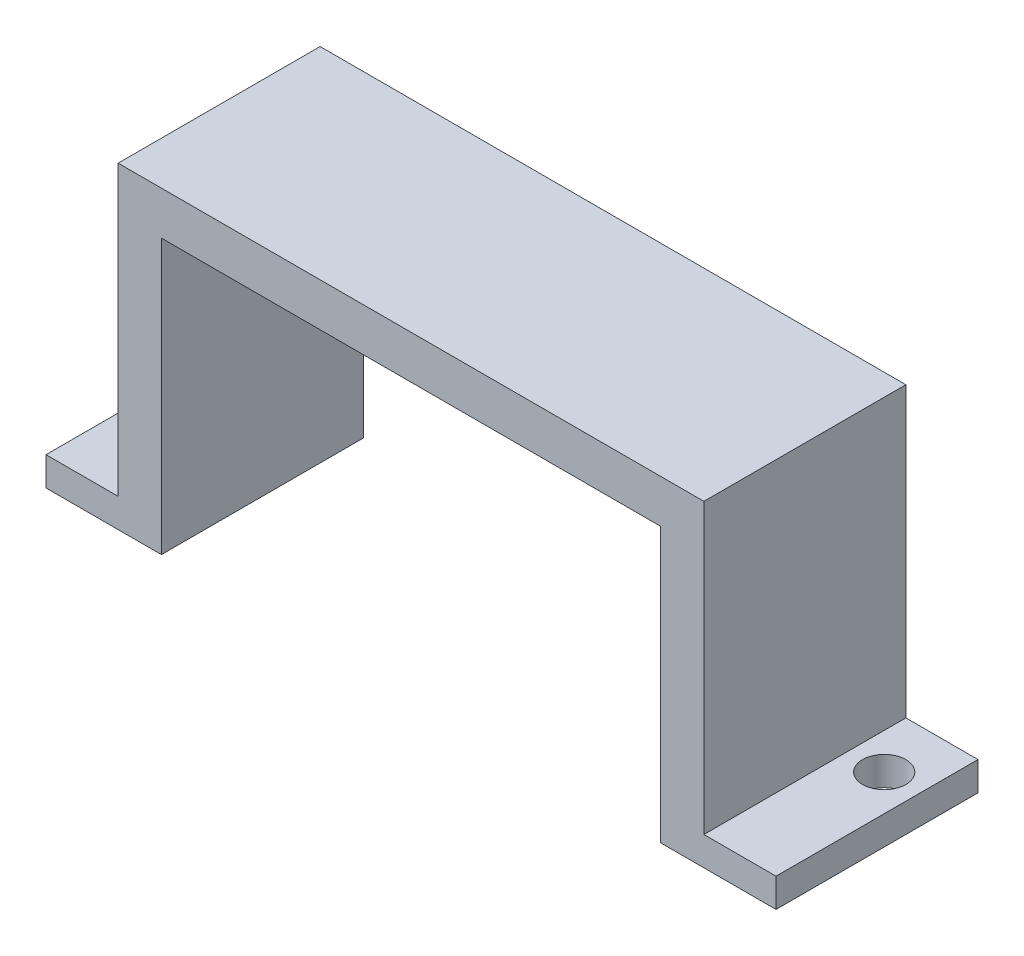
from build123d import *

# Parameters (mm, degrees)
BOSS_EXTRUDE1_DEPTH      = 14
F_3_0_3_DIAMETER_HOLE1_D = 3


with BuildPart() as part:
    # Sketch2 → Boss-Extrude1 (new body)
    with BuildSketch(Plane.XY):
        Polygon((-33.67, -3.38), (-25.67, -3.38), (-25.67, 15.62), (8.93, 15.62), (8.93, -3.38), (11.93, -3.38), (16.93, -3.38), (16.93, -1.38), (11.93, -1.38), (11.93, 18.62), (-28.67, 18.62), (-28.67, -1.38), (-33.67, -1.38), align=None)
    extrude(amount=BOSS_EXTRUDE1_DEPTH)

    # Ø3.0 (3) Diameter Hole1 (through all)
    with Locations(Plane(origin=(0, -1.38, 0), x_dir=(1, 0, 0), z_dir=(0, 1, 0))):
        with Locations((14.43, -4), (-31.17, -4)):
            Hole(F_3_0_3_DIAMETER_HOLE1_D / 2)


solid = part.part
